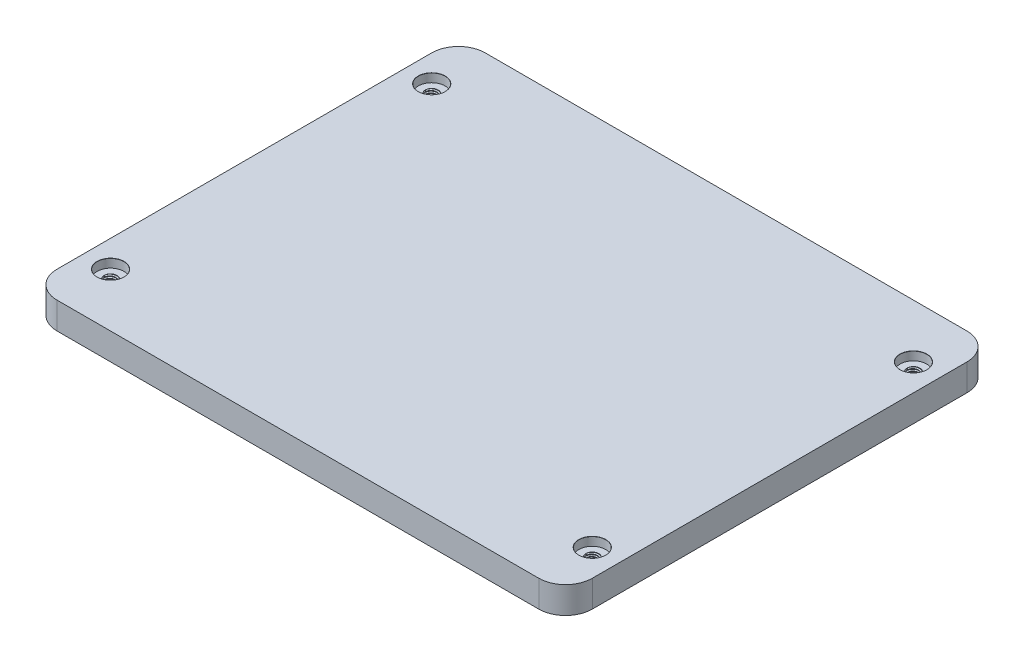
from build123d import *

# Parameters (mm, degrees)
SKETCH1_W                                     = 100
SKETCH1_H                                     = 80
BOSS_EXTRUDE1_DEPTH                           = 5
FILLET1_R                                     = 5
CUT_EXTRUDE4_DEPTH                            = 0.5
CBORE_FOR_M2_PAN_HEAD_MACHINE_SCREW1_AT_COUNT = 2
CBORE_FOR_M2_PAN_HEAD_MACHINE_SCREW1_AT_PITCH = 90
CBORE_FOR_M2_PAN_HEAD_MACHINE_SCREW1_2_COUNT  = 2
CBORE_FOR_M2_PAN_HEAD_MACHINE_SCREW1_2_PITCH  = 108.166538264
CBORE_FOR_M2_PAN_HEAD_MACHINE_SCREW1_3_COUNT  = 2
CBORE_FOR_M2_PAN_HEAD_MACHINE_SCREW1_3_PITCH  = 60
THREAD1_PITCH                                 = 0.4
THREAD2_PITCH                                 = 0.4
THREAD3_PITCH                                 = 0.4
THREAD4_PITCH                                 = 0.4


with BuildPart() as part:
    # Sketch1 → Boss-Extrude1 (new body)
    with BuildSketch(Plane(origin=(0, 0, 0), x_dir=(1, 0, 0), z_dir=(0, 1, 0))):
        Rectangle(SKETCH1_W, SKETCH1_H)
    extrude(amount=BOSS_EXTRUDE1_DEPTH)

    # Fillet1
    fillet1_edges = [part.edges().sort_by_distance(p)[0] for p in [
        (-50, 2.5, -40),
        (50, 2.5, -40),
        (50, 2.5, 40),
        (-50, 2.5, 40),
    ]]
    fillet(fillet1_edges, radius=FILLET1_R)

    # Sketch4 → Cut-Extrude4 (cut)
    with BuildSketch(Plane.XZ):
        with BuildLine():
            Line((25.218617079, 29.366275728), (24.136926805, 29.033396512))
            Line((24.136926805, 29.033396512), (24.677771942, 28.722097203))
            Line((24.677771942, 28.722097203), (24.677771942, 28.083851461))
            Line((24.677771942, 28.083851461), (23.800567732, 27.916307244))
            Line((23.800567732, 27.916307244), (23.860731953, 28.722097203))
            Line((23.860731953, 28.722097203), (23.800567732, 28.752963527))
            add(Edge.make_bspline(
                [(23.800567732, 28.752963527), (23.024253299, 29.140351109), (21.08303224, 29.172640443), (19.902370753, 26.821597013), (20.833040181, 24.088765521), (23.248957597, 24.149246367), (23.991062692, 24.927947918)],
                knots=[0, 0, 0, 0, 0.267186886, 0.468548887, 0.685024837, 1, 1, 1, 1], degree=3))
            Line((23.991062692, 24.927947918), (23.991062692, 25.28810424))
            Line((23.991062692, 25.28810424), (24.677771942, 25.24823509))
            Line((24.677771942, 25.24823509), (24.677771942, 24.744108955))
            Line((24.677771942, 24.744108955), (24.136926805, 24.577669348))
            Line((24.136926805, 24.577669348), (24.136926805, 24.330534932))
            Line((24.136926805, 24.330534932), (25.692616187, 24.330534932))
            Line((25.692616187, 24.330534932), (25.692616187, 24.577669348))
            Line((25.692616187, 24.577669348), (25.218617079, 24.794960127))
            Line((25.218617079, 24.794960127), (25.218617079, 25.166045519))
            Line((25.218617079, 25.166045519), (25.432233974, 25.133994049))
            ThreePointArc((25.432233974, 25.133994049), (25.88919682, 24.856236751), (26.136118998, 25.330571651))
            Line((26.136118998, 25.330571651), (26.275999706, 25.379821685))
            add(Edge.make_bspline(
                [(28.3348353, 24.7679479), (28.112132196, 24.41273064), (27.497321607, 24.297948889), (26.350064022, 24.394786915), (26.383927544, 25.152737568), (26.275999706, 25.379821685)],
                knots=[0, 0, 0, 0, 0.389848216, 0.700971282, 1, 1, 1, 1], degree=3))
            Line((28.3348353, 24.7679479), (28.3348353, 24.34155679))
            Line((28.3348353, 24.34155679), (29.363070824, 24.577669348))
            Line((29.363070824, 24.577669348), (29.363070824, 24.744108955))
            Line((29.363070824, 24.744108955), (28.889071715, 24.927947918))
            Line((28.889071715, 24.927947918), (28.889071715, 25.405938128))
            Line((28.889071715, 25.405938128), (29.653024325, 25.133994049))
            Line((29.653024325, 25.133994049), (29.653024325, 24.459613068))
            add(Edge.make_bspline(
                [(29.653024325, 24.459613068), (29.926703288, 24.36871586), (30.404699961, 24.196186692), (31.020827985, 24.322585388), (31.578719357, 24.47961339), (31.943173613, 24.730861841), (31.969251062, 25.020621314)],
                knots=[0, 0, 0, 0, 0.333928247, 0.549389048, 0.698567885, 1, 1, 1, 1], degree=3))
            Line((31.969251062, 25.020621314), (32.672791288, 25.096121017))
            Line((32.672791288, 25.096121017), (32.672791288, 24.855227618))
            add(Edge.make_bspline(
                [(34.322327493, 24.658268072), (34.087391925, 24.461964226), (33.457898526, 24.198375017), (32.778632643, 24.510551532), (32.672791288, 24.855227618)],
                knots=[0, 0, 0, 0, 0.479275291, 1, 1, 1, 1], degree=3))
            Line((34.322327493, 24.658268072), (34.322327493, 24.794960127))
            add(Edge.make_bspline(
                [(33.255463281, 25.015206986), (33.503192017, 24.623772895), (33.95133795, 24.823077468), (34.322327493, 24.794960127)],
                knots=[0, 0, 0, 0, 1, 1, 1, 1], degree=3))
            Line((33.255463281, 25.015206986), (33.255463281, 25.133994049))
            Line((33.255463281, 25.133994049), (34.530196375, 25.313860883))
            add(Edge.make_bspline(
                [(34.530196375, 25.313860883), (34.671439849, 24.749269405), (35.794120713, 23.853439521), (36.762212801, 24.59268089), (37.15362098, 24.794960127)],
                knots=[0, 0, 0, 0, 0.572484778, 1, 1, 1, 1], degree=3))
            Line((37.15362098, 24.794960127), (37.15362098, 25.096121017))
            add(Edge.make_bspline(
                [(35.198488159, 25.379821685), (35.308649976, 25.121639817), (35.89254974, 24.394357679), (36.806169883, 24.918335177), (37.15362098, 25.096121017)],
                knots=[0, 0, 0, 0, 0.391189252, 1, 1, 1, 1], degree=3))
            Line((35.198488159, 25.379821685), (35.638373298, 25.379821685))
            ThreePointArc((35.638373298, 25.379821685), (35.957241415, 25.016683142), (36.358555627, 25.28592909))
            Line((36.358555627, 25.28592909), (37.896297355, 25.189899833))
            Line((37.896297355, 25.189899833), (37.896297355, 24.794960127))
            Line((37.896297355, 24.794960127), (37.760912917, 24.659575689))
            Line((37.760912917, 24.659575689), (37.440853653, 24.582021336))
            Line((37.440853653, 24.582021336), (37.440853653, 24.395655342))
            Line((37.440853653, 24.395655342), (39.090389858, 24.395655342))
            Line((39.090389858, 24.395655342), (39.090389858, 24.582021336))
            Line((39.090389858, 24.582021336), (38.620797904, 24.659575689))
            Line((38.620797904, 24.659575689), (38.49130457, 24.789069023))
            Line((38.49130457, 24.789069023), (38.49130457, 25.189899833))
            Line((38.49130457, 25.189899833), (38.581303983, 25.189899833))
            ThreePointArc((38.581303983, 25.189899833), (39.156898839, 24.908848779), (39.090389858, 25.545932516))
            Line((39.090389858, 25.545932516), (39.195739618, 26.020435822))
            ThreePointArc((39.195739618, 26.020435822), (39.55720907, 26.589011743), (38.896692064, 26.45613576))
            Line((38.896692064, 26.45613576), (38.49130457, 26.540201709))
            Line((38.49130457, 26.540201709), (38.49130457, 26.767376553))
            add(Edge.make_bspline(
                [(38.49130457, 26.767376553), (38.646465309, 27.163203674), (39.673481964, 27.549979152), (39.71409509, 26.81661644)],
                knots=[0, 0, 0, 0, 1, 1, 1, 1], degree=3))
            Line((39.71409509, 26.81661644), (39.820781512, 26.81661644))
            Line((39.820781512, 26.81661644), (39.927467933, 26.81661644))
            Line((39.927467933, 26.81661644), (39.927467933, 27.559717057))
            add(Edge.make_bspline(
                [(38.49130457, 26.988956043), (38.607772127, 27.590027342), (39.439554438, 27.985532565), (39.927467933, 27.559717057)],
                knots=[0, 0, 0, 0, 1, 1, 1, 1], degree=3))
            Line((38.49130457, 26.988956043), (38.49130457, 27.664047539))
            Line((38.49130457, 27.664047539), (37.440853653, 27.409510176))
            Line((37.440853653, 27.409510176), (37.440853653, 27.27581812))
            Line((37.440853653, 27.27581812), (37.760912917, 27.222959487))
            Line((37.760912917, 27.222959487), (37.896297355, 27.034010531))
            Line((37.896297355, 27.034010531), (37.896297355, 26.68275464))
            Line((37.896297355, 26.68275464), (37.800903271, 26.700478959))
            ThreePointArc((37.800903271, 26.700478959), (37.616301676, 27.088824845), (37.189821116, 27.034010535))
            Line((37.189821116, 27.034010535), (37.028643295, 27.034010535))
            add(Edge.make_bspline(
                [(34.932381905, 27.338365723), (35.173708507, 27.605139761), (35.75998437, 27.697640876), (36.577647208, 27.621102314), (36.913739449, 27.251441055), (37.028643295, 27.034010535)],
                knots=[0, 0, 0, 0, 0.435858103, 0.689113588, 1, 1, 1, 1], degree=3))
            Line((34.932381905, 27.338365723), (34.354899584, 27.559717057))
            Line((34.354899584, 27.559717057), (34.387980675, 27.664047539))
            Line((34.387980675, 27.664047539), (33.255463281, 27.664047539))
            Line((33.255463281, 27.664047539), (33.255463281, 28.486569583))
            Line((33.255463281, 28.486569583), (32.763064413, 28.400499463))
            add(Edge.make_bspline(
                [(32.763064413, 28.400499463), (32.810964995, 28.217217163), (32.774527373, 28.029830231)],
                knots=[0, 0, 0, 1, 1, 1], degree=2))
            Line((32.774527373, 28.029830231), (32.685747468, 28.083851461))
            ThreePointArc((32.685747468, 28.083851461), (32.319535758, 28.45006317), (31.953324049, 28.083851461))
            Line((31.953324049, 28.083851461), (26.152822354, 28.133435495))
            ThreePointArc((26.152822354, 28.133435495), (25.84647695, 28.549897096), (25.428950825, 28.245004154))
            Line((25.428950825, 28.245004154), (25.218617079, 28.187959136))
            Line((25.218617079, 28.187959136), (25.218617079, 29.366275728))
        make_face()
        with BuildLine():
            Line((26.871537047, 25.531151352), (27.452880341, 25.745528447))
            ThreePointArc((27.452880341, 25.745528447), (27.737627138, 25.545283433), (28.061201941, 25.673650682))
            Line((28.061201941, 25.673650682), (28.3348353, 25.617050877))
            Line((28.3348353, 25.617050877), (28.3348353, 25.096121017))
            add(Edge.make_bspline(
                [(26.871537047, 25.379821685), (26.865328419, 24.633631358), (27.999195981, 24.545746598), (28.3348353, 25.096121017)],
                knots=[0, 0, 0, 0, 1, 1, 1, 1], degree=3))
            Line((26.871537047, 25.379821685), (26.871537047, 25.531151352))
        make_face(mode=Mode.SUBTRACT)
        with BuildLine():
            ThreePointArc((23.33458282, 25.484480407), (23.294692265, 25.629063014), (23.200187294, 25.745528447))
            Line((23.200187294, 25.745528447), (23.374279749, 26.336871446))
            ThreePointArc((23.374279749, 26.336871446), (23.512953395, 26.346824865), (23.637923449, 26.407750528))
            Line((23.637923449, 26.407750528), (24.677771942, 25.745528447))
            Line((24.677771942, 25.745528447), (24.677771942, 25.379821685))
            Line((24.677771942, 25.379821685), (23.86499775, 25.424247381))
            Line((23.86499775, 25.424247381), (23.33458282, 25.484480407))
        make_face(mode=Mode.SUBTRACT)
        with BuildLine():
            Line((22.703614742, 25.713686928), (22.102986902, 26.037936581))
            ThreePointArc((22.102986902, 26.037936581), (22.126880101, 26.134748667), (22.123771732, 26.234417132))
            Line((22.123771732, 26.234417132), (22.57332426, 26.391189961))
            Line((22.57332426, 26.391189961), (22.786796698, 25.779048977))
            ThreePointArc((22.786796698, 25.779048977), (22.742833094, 25.749387437), (22.703614742, 25.713686928))
        make_face(mode=Mode.SUBTRACT)
        with BuildLine():
            Line((23.200187294, 26.405991533), (23.051993402, 25.818142532))
            ThreePointArc((23.051993402, 25.818142532), (23.010816738, 25.825264046), (22.969096848, 25.827648231))
            Line((22.969096848, 25.827648231), (22.737034405, 26.440176875))
            Line((22.737034405, 26.440176875), (23.076205046, 26.568674976))
            ThreePointArc((23.076205046, 26.568674976), (23.126607578, 26.478501504), (23.200187294, 26.405991533))
        make_face(mode=Mode.SUBTRACT)
        with BuildLine():
            Line((24.677771942, 25.905114965), (23.727543425, 26.504987738))
            ThreePointArc((23.727543425, 26.504987738), (23.75437562, 26.555984279), (23.77287601, 26.610558535))
            Line((23.77287601, 26.610558535), (24.677771942, 26.700478959))
            Line((24.677771942, 26.700478959), (24.677771942, 25.905114965))
        make_face(mode=Mode.SUBTRACT)
        with BuildLine():
            Line((25.42701884, 25.283270488), (25.218617079, 25.325858573))
            Line((25.218617079, 25.325858573), (25.218617079, 25.405938128))
            Line((25.218617079, 25.405938128), (25.43189584, 25.304066209))
            ThreePointArc((25.43189584, 25.304066209), (25.429307724, 25.293703436), (25.42701884, 25.283270488))
        make_face(mode=Mode.SUBTRACT)
        with BuildLine():
            ThreePointArc((26.099411223, 25.405938128), (26.07901979, 25.434735419), (26.055951509, 25.461436522))
            Line((26.055951509, 25.461436522), (26.275999706, 25.713686928))
            Line((26.275999706, 25.713686928), (26.275999706, 25.461436522))
            Line((26.275999706, 25.461436522), (26.099411223, 25.405938128))
        make_face(mode=Mode.SUBTRACT)
        Polygon((28.3348353, 25.779048977), (28.142985965, 25.85617686), (28.3348353, 25.908965225), align=None, mode=Mode.SUBTRACT)
        with BuildLine():
            Line((29.872300631, 25.379821685), (29.653024325, 25.379821685))
            Line((29.653024325, 25.379821685), (29.653024325, 25.313623301))
            Line((29.653024325, 25.313623301), (28.889071715, 25.573979634))
            Line((28.889071715, 25.573979634), (28.889071715, 26.092269084))
            Line((28.889071715, 26.092269084), (29.721289234, 26.381775791))
            add(Edge.make_bspline(
                [(30.689603227, 25.713686928), (30.306259899, 25.81806201), (29.81931373, 25.940668923), (29.721289234, 26.381775791)],
                knots=[0, 0, 0, 0, 1, 1, 1, 1], degree=3))
            Line((30.689603227, 25.713686928), (30.689603227, 25.285929086))
            ThreePointArc((30.689603227, 25.285929086), (30.485349701, 25.2236771), (30.350537907, 25.058085456))
            Line((30.350537907, 25.058085456), (29.884584006, 25.24823509))
            Line((29.884584006, 25.24823509), (29.872300631, 25.379821685))
        make_face(mode=Mode.SUBTRACT)
        with BuildLine():
            Line((25.481973342, 25.405938128), (25.218617079, 25.573979634))
            Line((25.218617079, 25.573979634), (25.218617079, 26.767376553))
            Line((25.218617079, 26.767376553), (25.8286733, 26.849545711))
            Line((25.8286733, 26.849545711), (25.790692282, 25.575163462))
            ThreePointArc((25.790692282, 25.575163462), (25.614663451, 25.530082359), (25.481973342, 25.405938128))
        make_face(mode=Mode.SUBTRACT)
        with BuildLine():
            Line((25.964756735, 26.867874942), (26.275999706, 26.909796607))
            Line((26.275999706, 26.909796607), (26.275999706, 25.963050469))
            Line((26.275999706, 25.963050469), (25.964756735, 25.531151352))
            ThreePointArc((25.964756735, 25.531151352), (25.943058591, 25.541961548), (25.920692783, 25.551312506))
            Line((25.920692783, 25.551312506), (25.964756735, 26.867874942))
        make_face(mode=Mode.SUBTRACT)
        with BuildLine():
            Line((26.871537047, 26.568674976), (27.041216803, 26.767376553))
            ThreePointArc((27.041216803, 26.767376553), (27.199760612, 26.704255713), (27.369695122, 26.719832685))
            Line((27.369695122, 26.719832685), (27.578294495, 26.214225696))
            ThreePointArc((27.578294495, 26.214225696), (27.457955689, 26.082206075), (27.414387163, 25.908965225))
            Line((27.414387163, 25.908965225), (26.871537047, 25.713686928))
            Line((26.871537047, 25.713686928), (26.871537047, 26.568674976))
        make_face(mode=Mode.SUBTRACT)
        with BuildLine():
            Line((27.710997466, 26.268501955), (27.463221906, 26.767376553))
            ThreePointArc((27.463221906, 26.767376553), (27.528824323, 26.826689194), (27.578294495, 26.89999928))
            Line((27.578294495, 26.89999928), (28.3348353, 26.89999928))
            Line((28.3348353, 26.89999928), (28.3348353, 26.117515688))
            Line((28.3348353, 26.117515688), (28.123348644, 26.037936581))
            ThreePointArc((28.123348644, 26.037936581), (27.959323816, 26.228603163), (27.710997466, 26.268501955))
        make_face(mode=Mode.SUBTRACT)
        with BuildLine():
            Line((28.889071715, 26.295997729), (28.889071715, 26.849545712))
            Line((28.889071715, 26.849545712), (29.71351287, 26.81661644))
            add(Edge.make_bspline(
                [(29.694462028, 26.529762829), (29.680644812, 26.675091454), (29.71351287, 26.81661644)],
                knots=[0, 0, 0, 1, 1, 1], degree=2))
            Line((29.694462028, 26.529762829), (28.889071715, 26.295997729))
        make_face(mode=Mode.SUBTRACT)
        with BuildLine():
            add(Edge.make_bspline(
                [(29.94272356, 25.058085456), (30.101815999, 24.706479104), (30.517250307, 24.596598997)],
                knots=[0, 0, 0, 1, 1, 1], degree=2))
            Line((29.94272356, 25.058085456), (30.323391517, 24.919717377))
            ThreePointArc((30.323391517, 24.919717377), (30.375574029, 24.731311752), (30.517250307, 24.596598997))
        make_face(mode=Mode.SUBTRACT)
        with BuildLine():
            ThreePointArc((30.844905966, 24.588066845), (30.99862159, 24.723201049), (31.055814936, 24.919717377))
            Line((31.055814936, 24.919717377), (31.485203869, 24.965510808))
            add(Edge.make_bspline(
                [(30.844905966, 24.588066845), (31.255624394, 24.630252891), (31.485203869, 24.965510808)],
                knots=[0, 0, 0, 1, 1, 1], degree=2))
        make_face(mode=Mode.SUBTRACT)
        with BuildLine():
            Line((31.516872927, 25.113030782), (31.164180712, 25.096121021))
            Line((31.164180712, 25.096121021), (31.472252693, 25.28592909))
            add(Edge.make_bspline(
                [(31.516872927, 25.113030782), (31.512660645, 25.203903556), (31.472252693, 25.28592909)],
                knots=[0, 0, 0, 1, 1, 1], degree=2))
        make_face(mode=Mode.SUBTRACT)
        with BuildLine():
            Line((30.848229523, 25.249791178), (30.848229523, 25.663838963))
            add(Edge.make_bspline(
                [(31.384735814, 25.421270348), (31.17500082, 25.65821105), (30.848229523, 25.663838963)],
                knots=[0, 0, 0, 1, 1, 1], degree=2))
            Line((31.384735814, 25.421270348), (30.986582222, 25.133994049))
            ThreePointArc((30.986582222, 25.133994049), (30.924648519, 25.20054602), (30.848229523, 25.249791178))
        make_face(mode=Mode.SUBTRACT)
        with BuildLine():
            add(Edge.make_bspline(
                [(31.985446572, 25.208951752), (31.986560305, 25.370921167), (31.9632318, 25.531151353)],
                knots=[0, 0, 0, 1, 1, 1], degree=2))
            Line((31.9632318, 25.531151353), (32.672791288, 25.963050469))
            Line((32.672791288, 25.963050469), (32.672791288, 25.249791178))
            Line((32.672791288, 25.249791178), (31.985446572, 25.208951752))
        make_face(mode=Mode.SUBTRACT)
        with BuildLine():
            Line((33.255463281, 25.313623301), (33.255463281, 26.295997729))
            Line((33.255463281, 26.295997729), (33.451500877, 26.417562475))
            ThreePointArc((33.451500877, 26.417562475), (33.750362013, 26.244555734), (34.060220517, 26.396992667))
            Line((34.060220517, 26.396992667), (34.443907638, 26.121547047))
            add(Edge.make_bspline(
                [(34.443907638, 26.121547047), (34.40619596, 25.78434057), (34.485987513, 25.461559944)],
                knots=[0, 0, 0, 1, 1, 1], degree=2))
            Line((34.485987513, 25.461559944), (33.255463281, 25.313623301))
        make_face(mode=Mode.SUBTRACT)
        with BuildLine():
            Line((31.632751087, 26.700478959), (31.636478185, 26.610558535))
            Line((31.636478185, 26.610558535), (31.815886071, 26.610558535))
            Line((31.815886071, 26.610558535), (31.815886071, 26.662284447))
            Line((31.815886071, 26.662284447), (32.672791288, 26.662284447))
            Line((32.672791288, 26.662284447), (32.672791288, 26.149357942))
            Line((32.672791288, 26.149357942), (31.920613684, 25.713686929))
            add(Edge.make_bspline(
                [(31.920613684, 25.713686929), (31.795419335, 26.146520977), (31.237097797, 26.166105071), (30.883146012, 26.31772571)],
                knots=[0, 0, 0, 0, 1, 1, 1, 1], degree=3))
            Line((30.883146012, 26.31772571), (30.883146012, 26.410906318))
            ThreePointArc((30.883146012, 26.410906318), (31.064263893, 26.514643297), (31.159291018, 26.700478959))
            Line((31.159291018, 26.700478959), (31.632751087, 26.700478959))
        make_face(mode=Mode.SUBTRACT)
        with BuildLine():
            ThreePointArc((30.448432872, 26.662284447), (30.538614953, 26.510112393), (30.689603227, 26.417962066))
            Line((30.689603227, 26.417962066), (30.689603227, 26.381775791))
            add(Edge.make_bspline(
                [(30.689603227, 26.381775791), (30.444749183, 26.429461203), (30.275766246, 26.610558535)],
                knots=[0, 0, 0, 1, 1, 1], degree=2))
            Line((30.275766246, 26.610558535), (30.448432872, 26.662284447))
        make_face(mode=Mode.SUBTRACT)
        with BuildLine():
            Line((33.255463281, 26.455523937), (33.255463281, 26.610558535))
            Line((33.255463281, 26.610558535), (33.396518243, 26.610558535))
            ThreePointArc((33.396518243, 26.610558535), (33.397119484, 26.589582317), (33.398921234, 26.568674976))
            Line((33.398921234, 26.568674976), (33.255463281, 26.455523937))
        make_face(mode=Mode.SUBTRACT)
        with BuildLine():
            Line((34.128941662, 26.610558535), (34.576733575, 26.767376553))
            add(Edge.make_bspline(
                [(34.464903232, 26.29770634), (34.4989311, 26.53706416), (34.576733575, 26.767376553)],
                knots=[0, 0, 0, 1, 1, 1], degree=2))
            Line((34.464903232, 26.29770634), (34.113394782, 26.504987738))
            ThreePointArc((34.113394782, 26.504987738), (34.125034095, 26.557203829), (34.128941662, 26.610558535))
        make_face(mode=Mode.SUBTRACT)
        with BuildLine():
            Line((35.45239803, 25.531151353), (35.146195852, 25.531151353))
            add(Edge.make_bspline(
                [(35.107919881, 25.733945904), (35.118703273, 25.630883872), (35.146195852, 25.531151353)],
                knots=[0, 0, 0, 1, 1, 1], degree=2))
            Line((35.107919881, 25.733945904), (35.45239803, 25.531151353))
        make_face(mode=Mode.SUBTRACT)
        with BuildLine():
            Line((35.101959033, 25.908965225), (35.101959033, 26.214225696))
            Line((35.101959033, 26.214225696), (35.744542926, 26.214225696))
            Line((35.744542926, 26.214225696), (35.895623961, 25.729447924))
            ThreePointArc((35.895623961, 25.729447924), (35.776299429, 25.666172364), (35.688026914, 25.563946615))
            Line((35.688026914, 25.563946615), (35.101959033, 25.908965225))
        make_face(mode=Mode.SUBTRACT)
        with BuildLine():
            Line((37.02881844, 26.214225696), (37.15362098, 26.214225696))
            Line((37.15362098, 26.214225696), (37.15362098, 26.31772571))
            Line((37.15362098, 26.31772571), (37.276175377, 26.440280107))
            ThreePointArc((37.276175377, 26.440280107), (37.45703518, 26.401522515), (37.63376699, 26.456096193))
            Line((37.63376699, 26.456096193), (37.896297355, 26.117515688))
            Line((37.896297355, 26.117515688), (37.896297355, 25.325858573))
            Line((37.896297355, 25.325858573), (36.368443533, 25.421270348))
            ThreePointArc((36.368443533, 25.421270348), (36.343148746, 25.519412564), (36.291922962, 25.606863351))
            Line((36.291922962, 25.606863351), (37.02881844, 26.214225696))
        make_face(mode=Mode.SUBTRACT)
        with BuildLine():
            Line((36.033697118, 25.744874424), (35.957465752, 26.214225696))
            Line((35.957465752, 26.214225696), (36.743535715, 26.214225696))
            Line((36.743535715, 26.214225696), (36.211372944, 25.682062925))
            ThreePointArc((36.211372944, 25.682062925), (36.126644539, 25.7250933), (36.033697118, 25.744874424))
        make_face(mode=Mode.SUBTRACT)
        with BuildLine():
            Line((38.705783424, 25.484480407), (38.49130457, 25.729447924))
            Line((38.49130457, 25.729447924), (38.49130457, 26.381775791))
            Line((38.49130457, 26.381775791), (38.894707787, 26.31772571))
            ThreePointArc((38.894707787, 26.31772571), (38.944302157, 26.188366889), (39.038401402, 26.086687794))
            Line((39.038401402, 26.086687794), (38.922982549, 25.574373738))
            ThreePointArc((38.922982549, 25.574373738), (38.806974352, 25.54732772), (38.705783424, 25.484480407))
        make_face(mode=Mode.SUBTRACT)
        Polygon((37.896297355, 26.371990678), (37.728086324, 26.540201709), (37.896297355, 26.480148761), align=None, mode=Mode.SUBTRACT)
        with BuildLine():
            add(Edge.make_bspline(
                [(23.86499775, 25.28810424), (23.396987942, 24.570338979), (21.432289076, 24.528565166), (20.926090559, 26.481832342), (20.832742934, 27.975093291), (22.135930813, 28.910281407), (22.988516601, 28.474311228), (23.41787554, 28.303300302)],
                knots=[0, 0, 0, 0, 0.311243761, 0.483794583, 0.695630697, 0.819107924, 1, 1, 1, 1], degree=3))
            Line((23.41787554, 28.303300302), (23.568488782, 27.865759536))
            Line((23.568488782, 27.865759536), (22.566630614, 27.664047539))
            ThreePointArc((22.566630614, 27.664047539), (22.001849343, 27.857078638), (22.004839717, 27.260228617))
            Line((22.004839717, 27.260228617), (21.842328952, 26.5307234))
            ThreePointArc((21.842328952, 26.5307234), (21.410016261, 26.074658754), (22.01618033, 25.908965225))
            Line((22.01618033, 25.908965225), (22.620607158, 25.573979634))
            ThreePointArc((22.620607158, 25.573979634), (22.871924632, 25.108352146), (23.326098297, 25.379821685))
            Line((23.326098297, 25.379821685), (23.86499775, 25.28810424))
        make_face(mode=Mode.SUBTRACT)
        with BuildLine():
            ThreePointArc((22.045341971, 26.406135791), (21.987115221, 26.462667882), (21.917867393, 26.504987738))
            Line((21.917867393, 26.504987738), (22.116108709, 27.207277642))
            ThreePointArc((22.116108709, 27.207277642), (22.203097985, 27.193718632), (22.290809515, 27.201312595))
            Line((22.290809515, 27.201312595), (22.511429762, 26.568674976))
            Line((22.511429762, 26.568674976), (22.045341971, 26.406135791))
        make_face(mode=Mode.SUBTRACT)
        with BuildLine():
            Line((22.497930423, 27.32648414), (23.081228539, 26.844631005))
            ThreePointArc((23.081228539, 26.844631005), (23.067392148, 26.806650558), (23.057825921, 26.767376553))
            Line((23.057825921, 26.767376553), (22.668896491, 26.62002685))
            Line((22.668896491, 26.62002685), (22.426349816, 27.260228617))
            ThreePointArc((22.426349816, 27.260228617), (22.464355815, 27.290962602), (22.497930423, 27.32648414))
        make_face(mode=Mode.SUBTRACT)
        with BuildLine():
            Line((24.677771942, 26.844631005), (23.777925159, 26.767376553))
            ThreePointArc((23.777925159, 26.767376553), (23.768358932, 26.806650558), (23.754522542, 26.844631005))
            Line((23.754522542, 26.844631005), (24.677771942, 27.371135072))
            Line((24.677771942, 27.371135072), (24.677771942, 26.844631005))
        make_face(mode=Mode.SUBTRACT)
        with BuildLine():
            Line((23.637923449, 27.664047539), (23.800567732, 27.664047539))
            Line((23.800567732, 27.664047539), (23.800567732, 27.735760992))
            Line((23.800567732, 27.735760992), (24.677771942, 27.947795384))
            Line((24.677771942, 27.947795384), (24.677771942, 27.594191405))
            Line((24.677771942, 27.594191405), (23.654719483, 26.979792336))
            ThreePointArc((23.654719483, 26.979792336), (23.41787554, 27.066690668), (23.181031597, 26.979792336))
            Line((23.181031597, 26.979792336), (22.57332426, 27.481354911))
            ThreePointArc((22.57332426, 27.481354911), (22.578266119, 27.508918371), (22.581087386, 27.536778858))
            Line((22.581087386, 27.536778858), (23.613237759, 27.735760992))
            Line((23.613237759, 27.735760992), (23.637923449, 27.664047539))
        make_face(mode=Mode.SUBTRACT)
        Polygon((26.275999706, 27.066690668), (25.964756735, 27.027223651), (25.964756735, 27.200810705), align=None, mode=Mode.SUBTRACT)
        with BuildLine():
            ThreePointArc((26.89386127, 27.142126064), (26.887289259, 27.03607954), (26.911435951, 26.932609767))
            Line((26.911435951, 26.932609767), (26.871537047, 26.892710863))
            Line((26.871537047, 26.892710863), (26.871537047, 27.142126064))
            Line((26.871537047, 27.142126064), (26.89386127, 27.142126064))
        make_face(mode=Mode.SUBTRACT)
        Polygon((28.889071715, 27.006493556), (28.889071715, 27.27581812), (29.779158948, 27.006493556), align=None, mode=Mode.SUBTRACT)
        with BuildLine():
            Line((25.8286733, 27.418454651), (25.790692282, 27.409510176))
            Line((25.790692282, 27.409510176), (25.790692282, 27.27581812))
            Line((25.790692282, 27.27581812), (25.8286733, 27.259451436))
            Line((25.8286733, 27.259451436), (25.8286733, 27.009967656))
            Line((25.8286733, 27.009967656), (25.218617079, 26.932609767))
            Line((25.218617079, 26.932609767), (25.218617079, 27.693048432))
            Line((25.218617079, 27.693048432), (25.513737478, 27.948361446))
            ThreePointArc((25.513737478, 27.948361446), (25.6559301, 27.847444568), (25.8286733, 27.823722319))
            Line((25.8286733, 27.823722319), (25.8286733, 27.418454651))
        make_face(mode=Mode.SUBTRACT)
        with BuildLine():
            Line((26.871537047, 27.32648414), (26.871537047, 27.664047539))
            Line((26.871537047, 27.664047539), (26.527000255, 27.582909628))
            Line((26.527000255, 27.582909628), (26.099411223, 27.990972761))
            ThreePointArc((26.099411223, 27.990972761), (26.110798095, 28.010073542), (26.121004658, 28.029830231))
            Line((26.121004658, 28.029830231), (28.192261085, 27.504039704))
            Line((28.192261085, 27.504039704), (27.780598873, 27.409510176))
            Line((27.780598873, 27.409510176), (27.780598873, 27.27581812))
            Line((27.780598873, 27.27581812), (28.220611434, 27.142126064))
            Line((28.220611434, 27.142126064), (28.3348353, 27.066690664))
            Line((28.3348353, 27.066690664), (28.3348353, 27.027223651))
            Line((28.3348353, 27.027223651), (27.616298152, 27.027223651))
            ThreePointArc((27.616298152, 27.027223651), (27.378965772, 27.410269425), (26.949733036, 27.273119938))
            Line((26.949733036, 27.273119938), (26.871537047, 27.32648414))
        make_face(mode=Mode.SUBTRACT)
        with BuildLine():
            Line((25.964756735, 27.450502101), (25.964756735, 27.865759536))
            ThreePointArc((25.964756735, 27.865759536), (25.986905777, 27.878748397), (26.008090231, 27.893257341))
            Line((26.008090231, 27.893257341), (26.358192033, 27.543155538))
            Line((26.358192033, 27.543155538), (25.964756735, 27.450502101))
        make_face(mode=Mode.SUBTRACT)
        with BuildLine():
            Line((28.889071715, 27.481354911), (28.889071715, 27.664047539))
            Line((28.889071715, 27.664047539), (28.473292502, 27.568572629))
            Line((28.473292502, 27.568572629), (26.893861269, 27.964659681))
            Line((26.893861269, 27.964659681), (31.860105194, 27.917575707))
            Line((31.860105194, 27.917575707), (31.516872927, 27.620437773))
            add(Edge.make_bspline(
                [(29.854396524, 27.142126065), (30.198023856, 27.724587325), (30.933343323, 27.738793842), (31.516872927, 27.620437773)],
                knots=[0, 0, 0, 0, 1, 1, 1, 1], degree=3))
            Line((29.854396524, 27.142126065), (28.889071715, 27.481354911))
        make_face(mode=Mode.SUBTRACT)
        with BuildLine():
            Line((25.218617079, 27.865759536), (25.218617079, 27.997223898))
            Line((25.218617079, 27.997223898), (25.42856221, 28.133435495))
            ThreePointArc((25.42856221, 28.133435495), (25.440617078, 28.080449286), (25.460379906, 28.029830231))
            Line((25.460379906, 28.029830231), (25.218617079, 27.865759536))
        make_face(mode=Mode.SUBTRACT)
        Polygon((30.207054887, 26.81661644), (30.436355222, 26.81661644), (30.213821519, 26.767376554), align=None, mode=Mode.SUBTRACT)
        with BuildLine():
            ThreePointArc((30.986582261, 27.08204205), (30.729368517, 27.126860527), (30.507670659, 26.988955977))
            Line((30.507670659, 26.988955977), (30.237604136, 27.066690664))
            add(Edge.make_bspline(
                [(30.237604136, 27.066690664), (30.345531336, 27.443052866), (30.914412841, 27.412097311), (31.190409707, 27.285869614)],
                knots=[0, 0, 0, 0, 1, 1, 1, 1], degree=3))
            Line((31.190409707, 27.285869614), (30.986582261, 27.08204205))
        make_face(mode=Mode.SUBTRACT)
        with BuildLine():
            ThreePointArc((31.156115655, 26.849545712), (31.130872313, 26.92272112), (31.090812228, 26.988955977))
            Line((31.090812228, 26.988955977), (31.318850708, 27.216994547))
            add(Edge.make_bspline(
                [(31.318850708, 27.216994547), (31.519961034, 27.087324753), (31.602844461, 26.849545712)],
                knots=[0, 0, 0, 1, 1, 1], degree=2))
            Line((31.602844461, 26.849545712), (31.156115655, 26.849545712))
        make_face(mode=Mode.SUBTRACT)
        with BuildLine():
            Line((33.255463281, 26.767376553), (33.255463281, 26.976770245))
            Line((33.255463281, 26.976770245), (33.443041113, 26.789192412))
            ThreePointArc((33.443041113, 26.789192412), (33.43723434, 26.778378743), (33.431793213, 26.767376553))
            Line((33.431793213, 26.767376553), (33.255463281, 26.767376553))
        make_face(mode=Mode.SUBTRACT)
        with BuildLine():
            Line((33.255463281, 27.27581812), (34.264880959, 27.27581812))
            Line((34.264880959, 27.27581812), (34.295104041, 27.371135072))
            Line((34.295104041, 27.371135072), (34.820277946, 27.204613021))
            add(Edge.make_bspline(
                [(34.692001748, 27.006237676), (34.750153144, 27.109388149), (34.820277946, 27.204613021)],
                knots=[0, 0, 0, 1, 1, 1], degree=2))
            Line((34.692001748, 27.006237676), (34.093666691, 26.767376553))
            ThreePointArc((34.093666691, 26.767376553), (33.829421468, 26.970646382), (33.509905821, 26.875494329))
            Line((33.509905821, 26.875494329), (33.255463281, 27.142126064))
            Line((33.255463281, 27.142126064), (33.255463281, 27.27581812))
        make_face(mode=Mode.SUBTRACT)
        with BuildLine():
            Line((31.815886071, 26.849545712), (31.815886071, 27.559717057))
            Line((31.815886071, 27.559717057), (31.732091052, 27.577351757))
            Line((31.732091052, 27.577351757), (32.042182474, 27.844715156))
            ThreePointArc((32.042182474, 27.844715156), (32.261809695, 27.722218058), (32.508658332, 27.77025352))
            Line((32.508658332, 27.77025352), (32.591072932, 27.633595858))
            add(Edge.make_bspline(
                [(32.172185773, 27.481354911), (32.433932639, 27.456967567), (32.591072932, 27.633595858)],
                knots=[0, 0, 0, 1, 1, 1], degree=2))
            Line((32.172185773, 27.481354911), (32.172185773, 27.27581812))
            Line((32.172185773, 27.27581812), (32.672791288, 27.27581812))
            Line((32.672791288, 27.27581812), (32.672791288, 26.791928614))
            Line((32.672791288, 26.791928614), (31.815886071, 26.849545712))
        make_face(mode=Mode.SUBTRACT)
        with BuildLine():
            Line((35.101959033, 26.455523928), (35.101959033, 26.610558535))
            add(Edge.make_bspline(
                [(35.101959033, 26.610558535), (35.1475522, 26.775425087), (35.21510207, 26.932609767)],
                knots=[0, 0, 0, 1, 1, 1], degree=2))
            Line((35.21510207, 26.932609767), (35.452398016, 26.932609767))
            ThreePointArc((35.452398016, 26.932609767), (35.528310912, 26.750094191), (35.688026906, 26.633623146))
            Line((35.688026906, 26.633623146), (35.717927565, 26.455523928))
            Line((35.717927565, 26.455523928), (35.101959033, 26.455523928))
        make_face(mode=Mode.SUBTRACT)
        with BuildLine():
            Line((36.505295805, 26.455523928), (35.906210509, 26.455523928))
            Line((35.906210509, 26.455523928), (35.850384428, 26.612182226))
            ThreePointArc((35.850384428, 26.612182226), (36.048542114, 26.693916816), (36.167008421, 26.872558206))
            Line((36.167008421, 26.872558206), (36.505295806, 26.872558206))
            add(Edge.make_bspline(
                [(36.505295806, 26.872558206), (36.505295805, 26.664041067), (36.505295805, 26.455523928)],
                knots=[0, 0, 0, 1, 1, 1], degree=2))
        make_face(mode=Mode.SUBTRACT)
        with BuildLine():
            ThreePointArc((36.170937861, 27.066690664), (35.882718527, 27.336841484), (35.516792523, 27.18801269))
            Line((35.516792523, 27.18801269), (35.390479699, 27.222959487))
            add(Edge.make_bspline(
                [(35.390479699, 27.222959487), (35.507956784, 27.367934105), (35.952016469, 27.641386007), (36.344996395, 27.26209183), (36.43546434, 27.066690664)],
                knots=[0, 0, 0, 0, 0.460626921, 1, 1, 1, 1], degree=3))
            Line((36.43546434, 27.066690664), (36.170937861, 27.066690664))
        make_face(mode=Mode.SUBTRACT)
    extrude(amount=-CUT_EXTRUDE4_DEPTH, mode=Mode.SUBTRACT)

    # Sketch10 → CBORE for M2 Pan Head Machine Screw1 (revolve, cut)
    with BuildSketch(Plane(origin=(45, 5, -30), x_dir=(0, 0, 1), z_dir=(1, 0, 0))):
        Polygon((0, 0), (0, 5), (1.2, 5), (1.2, 1.6), (2.5, 1.6), (2.5, 0.025), (2.525, 0), align=None)
    cbore_for_m2_pan_head_machine_screw1 = revolve(axis=Axis((45, 11.35, -30), (0, -1, 0)), mode=Mode.SUBTRACT)

    # CBORE for M2 Pan Head Machine Screw1 at: CBORE for M2 Pan Head Machine Screw1 ×2
    with Locations(*[(-i * CBORE_FOR_M2_PAN_HEAD_MACHINE_SCREW1_AT_PITCH, 0, 0) for i in range(1, CBORE_FOR_M2_PAN_HEAD_MACHINE_SCREW1_AT_COUNT)]):
        add(cbore_for_m2_pan_head_machine_screw1, mode=Mode.SUBTRACT)

    # CBORE for M2 Pan Head Machine Screw1 2: CBORE for M2 Pan Head Machine Screw1 ×2
    with Locations(*[Vector(-0.8320502943378437, 0, 0.5547001962252293) * (i * CBORE_FOR_M2_PAN_HEAD_MACHINE_SCREW1_2_PITCH) for i in range(1, CBORE_FOR_M2_PAN_HEAD_MACHINE_SCREW1_2_COUNT)]):
        add(cbore_for_m2_pan_head_machine_screw1, mode=Mode.SUBTRACT)

    # CBORE for M2 Pan Head Machine Screw1 3: CBORE for M2 Pan Head Machine Screw1 ×2
    with Locations(*[(0, 0, i * CBORE_FOR_M2_PAN_HEAD_MACHINE_SCREW1_3_PITCH) for i in range(1, CBORE_FOR_M2_PAN_HEAD_MACHINE_SCREW1_3_COUNT)]):
        add(cbore_for_m2_pan_head_machine_screw1, mode=Mode.SUBTRACT)

    # Thread1: the profile of Thread Profile1 profile screwed along a right-hand helix of 8.5 turns, 6 arcs to a turn; built about Z, then put on its axis
    thread1_z = Axis((0, 0, 0), (0, 0, 1))
    thread1_corners = [(1.2003, 0, -0.000173205), (1.2003, 0, 0.350173204), (0.98349365, 0, 0.224999999), (0.98349365, 0, 0.124999999)]
    with BuildLine(mode=Mode.PRIVATE) as thread1_profile:
        Line(thread1_corners[0], thread1_corners[1])
        Line(thread1_corners[1], thread1_corners[2])
        Line(thread1_corners[2], thread1_corners[3])
        Line(thread1_corners[3], thread1_corners[0])
    thread1_cap = Face(thread1_profile.wire())
    thread1_turn_angles = [0, 30, 60, 90, 120, 150, 180, 210, 240, 270, 300, 330, 360]
    thread1_turn_weights = [1, 0.8660254037844387, 1, 0.8660254037844387, 1, 0.8660254037844387, 1, 0.8660254037844387, 1, 0.8660254037844387, 1, 0.8660254037844387, 1]
    thread1_turn_rails = [Edge.make_bspline([Vector(p[0], p[1], 0).rotate(thread1_z, thread1_turn_angles[k]) / thread1_turn_weights[k] + Vector(0, 0, p[2] + THREAD1_PITCH * thread1_turn_angles[k] / 360) for k in range(13)], [0, 0, 0, 1, 1, 2, 2, 3, 3, 4, 4, 5, 5, 6, 6, 6], 2, thread1_turn_weights) for p in thread1_corners]
    thread1_turn_sides = [Face.make_surface_from_curves(thread1_turn_rails[p[0]], thread1_turn_rails[p[1]]) for p in [(0, 1), (1, 2), (2, 3), (3, 0)]]
    thread1_last_angles = [2880, 2910, 2940, 2970, 3000, 3030, 3060]
    thread1_last_weights = [1, 0.8660254037844387, 1, 0.8660254037844387, 1, 0.8660254037844367, 1]
    thread1_last_rails = [Edge.make_bspline([Vector(p[0], p[1], 0).rotate(thread1_z, thread1_last_angles[k]) / thread1_last_weights[k] + Vector(0, 0, p[2] + THREAD1_PITCH * thread1_last_angles[k] / 360) for k in range(7)], [0, 0, 0, 1, 1, 2, 2, 3, 3, 3], 2, thread1_last_weights) for p in thread1_corners]
    thread1_last_sides = [Face.make_surface_from_curves(thread1_last_rails[p[0]], thread1_last_rails[p[1]]) for p in [(0, 1), (1, 2), (2, 3), (3, 0)]]
    thread1 = Plane(origin=(-45, 3.4, -30), x_dir=(-1, 0, 0), z_dir=(0, -1, 0)) * Solid(Shell([*[p.moved(Location((0, 0, THREAD1_PITCH * i))) for i in range(8) for p in thread1_turn_sides], *thread1_last_sides, thread1_cap, thread1_cap.rotate(thread1_z, 3060).moved(Location((0, 0, THREAD1_PITCH * 3060 / 360)))]))
    add(thread1)

    # Thread2: the profile of Thread Profile2 profile screwed along a right-hand helix of 8.5 turns, 6 arcs to a turn; built about Z, then put on its axis
    thread2_z = Axis((0, 0, 0), (0, 0, 1))
    thread2_corners = [(1.2003, 0, -0.000173205), (1.2003, 0, 0.350173204), (0.98349365, 0, 0.224999999), (0.98349365, 0, 0.124999999)]
    with BuildLine(mode=Mode.PRIVATE) as thread2_profile:
        Line(thread2_corners[0], thread2_corners[1])
        Line(thread2_corners[1], thread2_corners[2])
        Line(thread2_corners[2], thread2_corners[3])
        Line(thread2_corners[3], thread2_corners[0])
    thread2_cap = Face(thread2_profile.wire())
    thread2_turn_angles = [0, 30, 60, 90, 120, 150, 180, 210, 240, 270, 300, 330, 360]
    thread2_turn_weights = [1, 0.8660254037844387, 1, 0.8660254037844387, 1, 0.8660254037844387, 1, 0.8660254037844387, 1, 0.8660254037844387, 1, 0.8660254037844387, 1]
    thread2_turn_rails = [Edge.make_bspline([Vector(p[0], p[1], 0).rotate(thread2_z, thread2_turn_angles[k]) / thread2_turn_weights[k] + Vector(0, 0, p[2] + THREAD2_PITCH * thread2_turn_angles[k] / 360) for k in range(13)], [0, 0, 0, 1, 1, 2, 2, 3, 3, 4, 4, 5, 5, 6, 6, 6], 2, thread2_turn_weights) for p in thread2_corners]
    thread2_turn_sides = [Face.make_surface_from_curves(thread2_turn_rails[p[0]], thread2_turn_rails[p[1]]) for p in [(0, 1), (1, 2), (2, 3), (3, 0)]]
    thread2_last_angles = [2880, 2910, 2940, 2970, 3000, 3030, 3060]
    thread2_last_weights = [1, 0.8660254037844387, 1, 0.8660254037844387, 1, 0.8660254037844367, 1]
    thread2_last_rails = [Edge.make_bspline([Vector(p[0], p[1], 0).rotate(thread2_z, thread2_last_angles[k]) / thread2_last_weights[k] + Vector(0, 0, p[2] + THREAD2_PITCH * thread2_last_angles[k] / 360) for k in range(7)], [0, 0, 0, 1, 1, 2, 2, 3, 3, 3], 2, thread2_last_weights) for p in thread2_corners]
    thread2_last_sides = [Face.make_surface_from_curves(thread2_last_rails[p[0]], thread2_last_rails[p[1]]) for p in [(0, 1), (1, 2), (2, 3), (3, 0)]]
    thread2 = Plane(origin=(-45, 3.4, 30), x_dir=(-1, 0, 0), z_dir=(0, -1, 0)) * Solid(Shell([*[p.moved(Location((0, 0, THREAD2_PITCH * i))) for i in range(8) for p in thread2_turn_sides], *thread2_last_sides, thread2_cap, thread2_cap.rotate(thread2_z, 3060).moved(Location((0, 0, THREAD2_PITCH * 3060 / 360)))]))
    add(thread2)

    # Thread3: the profile of Thread Profile3 profile screwed along a right-hand helix of 8.5 turns, 6 arcs to a turn; built about Z, then put on its axis
    thread3_z = Axis((0, 0, 0), (0, 0, 1))
    thread3_corners = [(1.2003, 0, -0.000173205), (1.2003, 0, 0.350173204), (0.98349365, 0, 0.224999999), (0.98349365, 0, 0.124999999)]
    with BuildLine(mode=Mode.PRIVATE) as thread3_profile:
        Line(thread3_corners[0], thread3_corners[1])
        Line(thread3_corners[1], thread3_corners[2])
        Line(thread3_corners[2], thread3_corners[3])
        Line(thread3_corners[3], thread3_corners[0])
    thread3_cap = Face(thread3_profile.wire())
    thread3_turn_angles = [0, 30, 60, 90, 120, 150, 180, 210, 240, 270, 300, 330, 360]
    thread3_turn_weights = [1, 0.8660254037844387, 1, 0.8660254037844387, 1, 0.8660254037844387, 1, 0.8660254037844387, 1, 0.8660254037844387, 1, 0.8660254037844387, 1]
    thread3_turn_rails = [Edge.make_bspline([Vector(p[0], p[1], 0).rotate(thread3_z, thread3_turn_angles[k]) / thread3_turn_weights[k] + Vector(0, 0, p[2] + THREAD3_PITCH * thread3_turn_angles[k] / 360) for k in range(13)], [0, 0, 0, 1, 1, 2, 2, 3, 3, 4, 4, 5, 5, 6, 6, 6], 2, thread3_turn_weights) for p in thread3_corners]
    thread3_turn_sides = [Face.make_surface_from_curves(thread3_turn_rails[p[0]], thread3_turn_rails[p[1]]) for p in [(0, 1), (1, 2), (2, 3), (3, 0)]]
    thread3_last_angles = [2880, 2910, 2940, 2970, 3000, 3030, 3060]
    thread3_last_weights = [1, 0.8660254037844387, 1, 0.8660254037844387, 1, 0.8660254037844367, 1]
    thread3_last_rails = [Edge.make_bspline([Vector(p[0], p[1], 0).rotate(thread3_z, thread3_last_angles[k]) / thread3_last_weights[k] + Vector(0, 0, p[2] + THREAD3_PITCH * thread3_last_angles[k] / 360) for k in range(7)], [0, 0, 0, 1, 1, 2, 2, 3, 3, 3], 2, thread3_last_weights) for p in thread3_corners]
    thread3_last_sides = [Face.make_surface_from_curves(thread3_last_rails[p[0]], thread3_last_rails[p[1]]) for p in [(0, 1), (1, 2), (2, 3), (3, 0)]]
    thread3 = Plane(origin=(45, 3.4, 30), x_dir=(-1, 0, 0), z_dir=(0, -1, 0)) * Solid(Shell([*[p.moved(Location((0, 0, THREAD3_PITCH * i))) for i in range(8) for p in thread3_turn_sides], *thread3_last_sides, thread3_cap, thread3_cap.rotate(thread3_z, 3060).moved(Location((0, 0, THREAD3_PITCH * 3060 / 360)))]))
    add(thread3)

    # Thread4: the profile of Thread Profile4 profile screwed along a right-hand helix of 8.5 turns, 6 arcs to a turn; built about Z, then put on its axis
    thread4_z = Axis((0, 0, 0), (0, 0, 1))
    thread4_corners = [(1.2003, 0, -0.000173205), (1.2003, 0, 0.350173204), (0.98349365, 0, 0.224999999), (0.98349365, 0, 0.124999999)]
    with BuildLine(mode=Mode.PRIVATE) as thread4_profile:
        Line(thread4_corners[0], thread4_corners[1])
        Line(thread4_corners[1], thread4_corners[2])
        Line(thread4_corners[2], thread4_corners[3])
        Line(thread4_corners[3], thread4_corners[0])
    thread4_cap = Face(thread4_profile.wire())
    thread4_turn_angles = [0, 30, 60, 90, 120, 150, 180, 210, 240, 270, 300, 330, 360]
    thread4_turn_weights = [1, 0.8660254037844387, 1, 0.8660254037844387, 1, 0.8660254037844387, 1, 0.8660254037844387, 1, 0.8660254037844387, 1, 0.8660254037844387, 1]
    thread4_turn_rails = [Edge.make_bspline([Vector(p[0], p[1], 0).rotate(thread4_z, thread4_turn_angles[k]) / thread4_turn_weights[k] + Vector(0, 0, p[2] + THREAD4_PITCH * thread4_turn_angles[k] / 360) for k in range(13)], [0, 0, 0, 1, 1, 2, 2, 3, 3, 4, 4, 5, 5, 6, 6, 6], 2, thread4_turn_weights) for p in thread4_corners]
    thread4_turn_sides = [Face.make_surface_from_curves(thread4_turn_rails[p[0]], thread4_turn_rails[p[1]]) for p in [(0, 1), (1, 2), (2, 3), (3, 0)]]
    thread4_last_angles = [2880, 2910, 2940, 2970, 3000, 3030, 3060]
    thread4_last_weights = [1, 0.8660254037844387, 1, 0.8660254037844387, 1, 0.8660254037844367, 1]
    thread4_last_rails = [Edge.make_bspline([Vector(p[0], p[1], 0).rotate(thread4_z, thread4_last_angles[k]) / thread4_last_weights[k] + Vector(0, 0, p[2] + THREAD4_PITCH * thread4_last_angles[k] / 360) for k in range(7)], [0, 0, 0, 1, 1, 2, 2, 3, 3, 3], 2, thread4_last_weights) for p in thread4_corners]
    thread4_last_sides = [Face.make_surface_from_curves(thread4_last_rails[p[0]], thread4_last_rails[p[1]]) for p in [(0, 1), (1, 2), (2, 3), (3, 0)]]
    thread4 = Plane(origin=(45, 3.4, -30), x_dir=(-1, 0, 0), z_dir=(0, -1, 0)) * Solid(Shell([*[p.moved(Location((0, 0, THREAD4_PITCH * i))) for i in range(8) for p in thread4_turn_sides], *thread4_last_sides, thread4_cap, thread4_cap.rotate(thread4_z, 3060).moved(Location((0, 0, THREAD4_PITCH * 3060 / 360)))]))
    add(thread4)


solid = part.part
